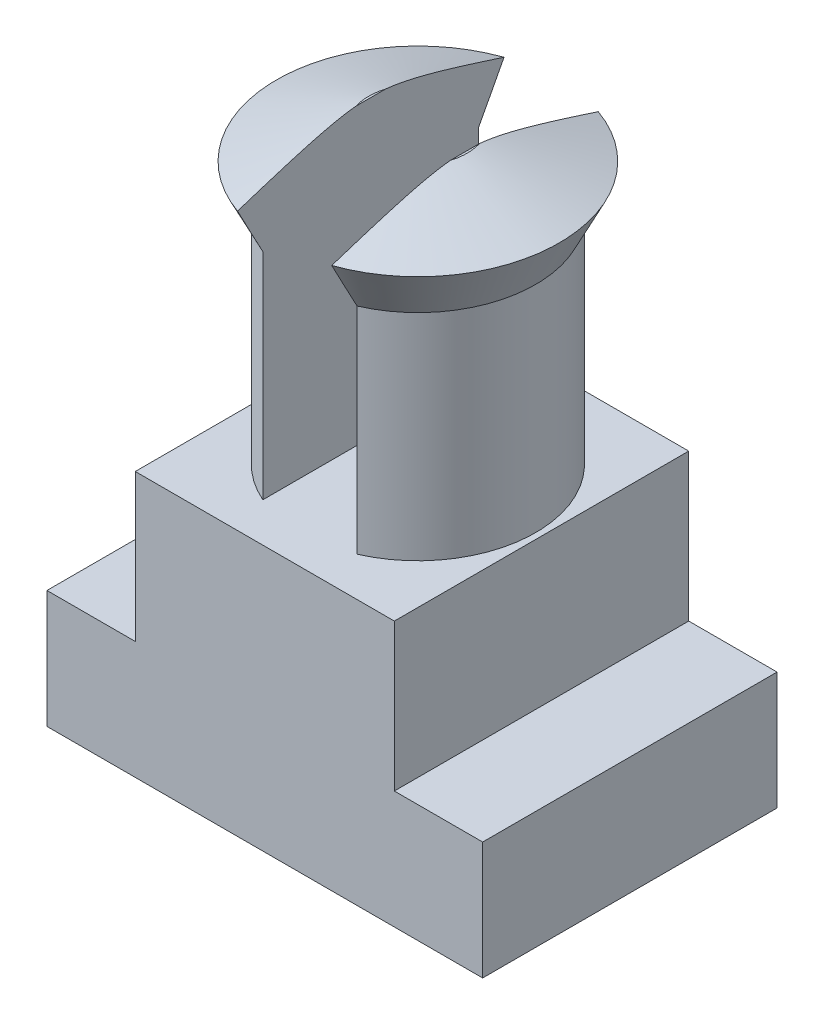
from build123d import *

# Parameters (mm, degrees)
BOSS_EXTRUDE1_DEPTH     = 3.175
CUT_EXTRUDE1_DEPTH      = 16.619451143
CUT_EXTRUDE1_DEPTH_BACK = 16.619451143
SKETCH4_W               = 2.032
SKETCH4_H               = 12.7


with BuildPart() as part:
    # Sketch1 → Boss-Extrude1 (new, symmetric)
    with BuildSketch(Plane.XY):
        Polygon((0, 0), (9.398, 0), (9.398, 2.54), (7.493, 2.54), (7.493, 5.715), (1.905, 5.715), (1.905, 2.54), (0, 2.54), align=None)
    extrude(amount=BOSS_EXTRUDE1_DEPTH, both=True)

    # Sketch3 → Revolve1 (revolve)
    with BuildSketch(Plane.XY):
        Polygon((3.76219647, 12.065), (4.326476153, 12.065), (4.326476153, 5.715), (2.286, 5.715), (2.286, 10.3505), (1.778, 11.38048125), align=None)
    revolve(axis=Axis((4.826, 5.715, 0), (0, 1, 0)))

    # Sketch4 → Cut-Extrude1 (cut, two sides: drawn at the far end of the back side and taken through both)
    with BuildSketch(Plane.XY.offset(-CUT_EXTRUDE1_DEPTH_BACK)):
        with Locations((4.826, 12.065)):
            Rectangle(SKETCH4_W, SKETCH4_H)
    extrude(amount=CUT_EXTRUDE1_DEPTH + CUT_EXTRUDE1_DEPTH_BACK, mode=Mode.SUBTRACT)


solid = part.part
